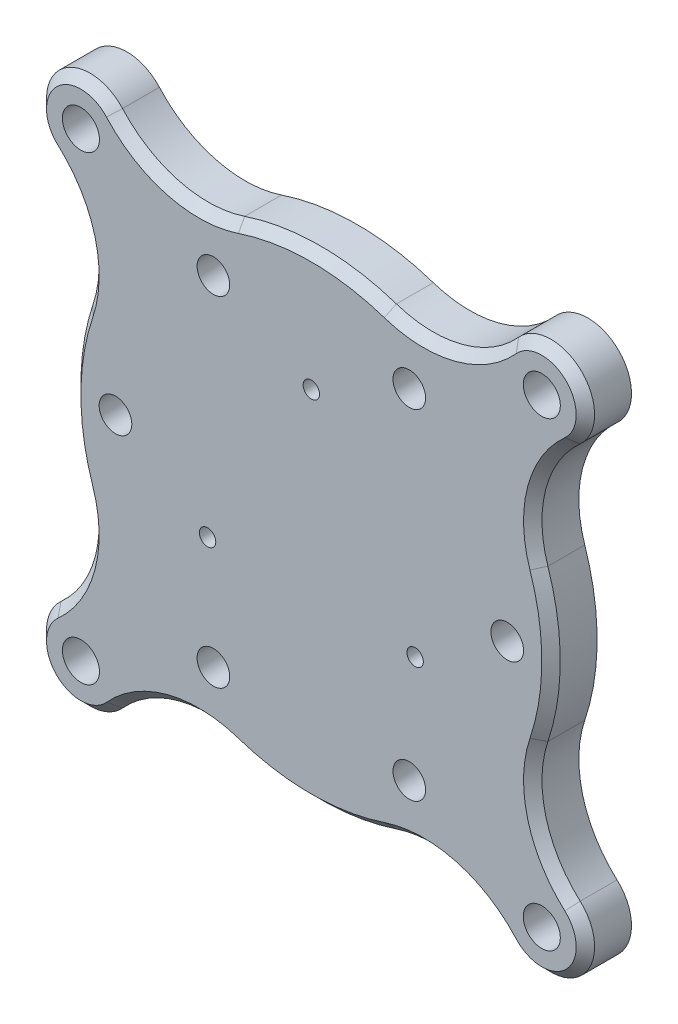
from build123d import *

# Parameters (mm, degrees)
SKETCH1_R                                      = 53.975
BOSS_EXTRUDE1_DEPTH                            = 6.35
CSK_FOR_8_FLAT_HEAD_MACHINE_SCREW1_D           = 4.4958
CSK_FOR_8_FLAT_HEAD_MACHINE_SCREW1_CSINK_D     = 9.7575878
CSK_FOR_8_FLAT_HEAD_MACHINE_SCREW1_CSINK_ANGLE = 82
CIRPATTERN1_COUNT                              = 6
F_10_CLEARANCE_HOLE1_D                         = 5.1054
CIRPATTERN2_COUNT                              = 4
F_4_40_TAPPED_HOLE1_D                          = 2.2606
CIRPATTERN3_COUNT                              = 3
CUT_EXTRUDE2_DEPTH                             = 77.59584682
CIRPATTERN4_COUNT                              = 4
CHAMFER1_SIZE                                  = 1.27


with BuildPart() as part:
    # Sketch1 → Boss-Extrude1 (new body)
    with BuildSketch(Plane.XY):
        Circle(SKETCH1_R)
    extrude(amount=BOSS_EXTRUDE1_DEPTH)

    # CSK for #8 Flat Head Machine Screw1 (through all)
    with Locations(Plane(origin=(0, 0, 0), x_dir=(-1, 0, 0), z_dir=(0, 0, -1))):
        with Locations((-13.49375, 23.371860585)):
            csk_for_8_flat_head_machine_screw1 = CounterSinkHole(CSK_FOR_8_FLAT_HEAD_MACHINE_SCREW1_D / 2, CSK_FOR_8_FLAT_HEAD_MACHINE_SCREW1_CSINK_D / 2, counter_sink_angle=CSK_FOR_8_FLAT_HEAD_MACHINE_SCREW1_CSINK_ANGLE)

    # CirPattern1: CSK for #8 Flat Head Machine Screw1 ×6 about axis
    cirpattern1_axis = Axis((0, 0, 6.35), (0, 0, -1))
    for i in range(1, CIRPATTERN1_COUNT):
        add(csk_for_8_flat_head_machine_screw1.rotate(cirpattern1_axis, i * 360 / CIRPATTERN1_COUNT), mode=Mode.SUBTRACT)

    # #10 Clearance Hole1 (through all)
    with Locations(Plane.XY.offset(6.35)):
        with Locations((31.75, 31.75)):
            f_10_clearance_hole1 = Hole(F_10_CLEARANCE_HOLE1_D / 2)

    # CirPattern2: #10 Clearance Hole1 ×4 about axis
    cirpattern2_axis = Axis((0, 0, 6.35), (0, 0, -1))
    for i in range(1, CIRPATTERN2_COUNT):
        add(f_10_clearance_hole1.rotate(cirpattern2_axis, i * 360 / CIRPATTERN2_COUNT), mode=Mode.SUBTRACT)

    # #4-40 Tapped Hole1 (through all)
    with Locations(Plane.XY.offset(6.35)):
        with Locations((0, 16.51)):
            f_4_40_tapped_hole1 = Hole(F_4_40_TAPPED_HOLE1_D / 2)

    # CirPattern3: #4-40 Tapped Hole1 ×3 about axis
    cirpattern3_axis = Axis((0, 0, 6.35), (0, 0, -1))
    for i in range(1, CIRPATTERN3_COUNT):
        add(f_4_40_tapped_hole1.rotate(cirpattern3_axis, i * 360 / CIRPATTERN3_COUNT), mode=Mode.SUBTRACT)

    # Sketch9 → Cut-Extrude2 (cut, through all)
    with BuildSketch(Plane(origin=(0, 0, 0), x_dir=(-1, 0, 0), z_dir=(0, 0, -1))):
        with BuildLine():
            Line((-35.997661145, 35.997661145), (-38.166088515, 38.166088515))
            ThreePointArc((-38.166088515, 38.166088515), (0, 53.975), (38.166088515, 38.166088515))
            Line((38.166088515, 38.166088515), (35.997661145, 35.997661145))
            ThreePointArc((35.997661145, 35.997661145), (31.590630973, 37.754985589), (27.283015751, 35.766379231))
            ThreePointArc((27.283015751, 35.766379231), (19.531362633, 31.031658723), (10.452735489, 31.321888845))
            ThreePointArc((10.452735489, 31.321888845), (0, 33.02), (-10.452735489, 31.321888845))
            ThreePointArc((-10.452735489, 31.321888845), (-19.531362633, 31.031658723), (-27.283015751, 35.766379231))
            ThreePointArc((-27.283015751, 35.766379231), (-31.590630973, 37.754985589), (-35.997661145, 35.997661145))
        make_face()
    cut_extrude2 = extrude(amount=-CUT_EXTRUDE2_DEPTH, mode=Mode.SUBTRACT)

    # CirPattern4: Cut-Extrude2 ×4 about axis
    cirpattern4_axis = Axis((0, 0, 6.35), (0, 0, -1))
    for i in range(1, CIRPATTERN4_COUNT):
        add(cut_extrude2.rotate(cirpattern4_axis, i * 360 / CIRPATTERN4_COUNT), mode=Mode.SUBTRACT)

    # Chamfer1
    chamfer1_edges = [part.edges().sort_by_distance(p)[0] for p in [
        (-33.02, 0, 6.35),
        (-31.031658723, -19.531362633, 6.35),
        (-31.031658723, 19.531362633, 6.35),
        (-35.997661145, -35.997661145, 6.35),
        (-35.997661145, 35.997661145, 6.35),
        (-19.531362633, -31.031658723, 6.35),
        (-19.531362633, 31.031658723, 6.35),
        (0, -33.02, 6.35),
        (0, 33.02, 6.35),
        (19.531362633, -31.031658723, 6.35),
        (19.531362633, 31.031658723, 6.35),
        (35.997661145, -35.997661145, 6.35),
        (35.997661145, 35.997661145, 6.35),
        (31.031658723, -19.531362633, 6.35),
        (31.031658723, 19.531362633, 6.35),
        (33.02, 0, 6.35),
    ]]
    chamfer(chamfer1_edges, length=CHAMFER1_SIZE)


solid = part.part
